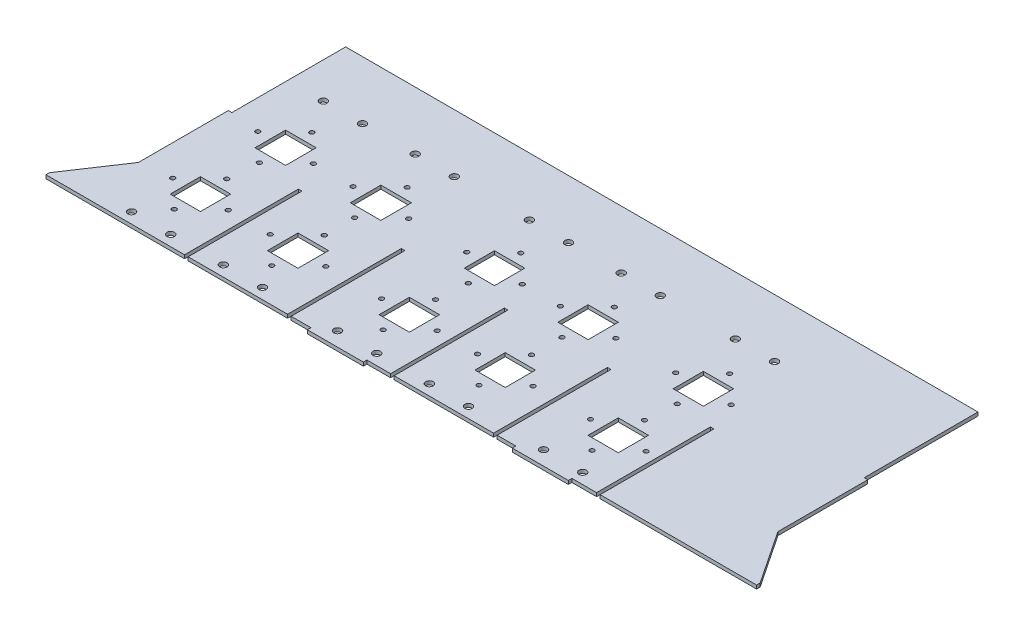
from build123d import *

# Parameters (mm, degrees)
SKETCH1_W            = 570.861
SKETCH1_H            = 3.175
BOSS_EXTRUDE1_DEPTH  = 232.6
SKETCH6_W            = 50
SKETCH6_H            = 3.175
BOSS_EXTRUDE2_DEPTH  = 3.175
SKETCH2_W            = 3.175
SKETCH2_H            = 101.6
CUT_EXTRUDE5_DEPTH   = 371.230335845
BOSS_EXTRUDE3_DEPTH  = 3.175
SKETCH13_W           = 3.175
SKETCH13_H           = 101.6
CUT_EXTRUDE6_DEPTH   = 396.22575932
LPATTERN2_COUNT      = 5
LPATTERN2_PITCH      = 91.9550104
M6_CLEARANCE_HOLE1_D = 6.6
M6_CLEARANCE_HOLE2_D = 6.6
LPATTERN3_COUNT      = 3
LPATTERN3_PITCH      = 183.919999952
LPATTERN4_COUNT      = 2
LPATTERN4_PITCH      = 183.919999952
SKETCH19_W           = 27.300958655
SKETCH19_H           = 27.304060113
SKETCH19_W_2         = 27
SKETCH19_H_2         = 27
CUT_EXTRUDE7_DEPTH   = 396.22575932
SKETCH20_R           = 2
CUT_EXTRUDE8_DEPTH   = 396.327709896


with BuildPart() as part:
    # Sketch1 → Boss-Extrude1 (new body)
    with BuildSketch(Plane.XY):
        Rectangle(SKETCH1_W, SKETCH1_H)
    extrude(amount=BOSS_EXTRUDE1_DEPTH)

    # Sketch6 → Boss-Extrude2 (add)
    with BuildSketch(Plane.XY.offset(232.6)):
        with Locations((127.26300405, 0)):
            Rectangle(SKETCH6_W, SKETCH6_H)
        with Locations((-55.6950692, 0)):
            Rectangle(SKETCH6_W, SKETCH6_H)
    extrude(amount=BOSS_EXTRUDE2_DEPTH)

    # Sketch2 → Cut-Extrude5 (cut, through all)
    with BuildSketch(Plane(origin=(0, 1.5875, 0), x_dir=(1, 0, 0), z_dir=(0, 1, 0))):
        with Locations((283.843, -50.8)):
            Rectangle(SKETCH2_W, SKETCH2_H)
        with Locations((-283.843, -50.8)):
            Rectangle(SKETCH2_W, SKETCH2_H)
    extrude(amount=-CUT_EXTRUDE5_DEPTH, mode=Mode.SUBTRACT)

    # Sketch12 → Boss-Extrude3 (add)
    with BuildSketch(Plane(origin=(0, 1.5875, 0), x_dir=(1, 0, 0), z_dir=(0, 1, 0))):
        Polygon((-317.1805, -232.6), (-285.4305, -232.6), (-285.4305, -181.8), (-317.1805, -229.425), align=None)
    boss_extrude3 = extrude(amount=-BOSS_EXTRUDE3_DEPTH)

    # Mirror1: Boss-Extrude3 across plane
    add(boss_extrude3.mirror(Plane(origin=(0, 0, 0), x_dir=(0, 0, 1), z_dir=(1, 0, 0))))

    # Sketch13 → Cut-Extrude6 (cut, through all)
    with BuildSketch(Plane.XZ.offset(1.5875)):
        with Locations((-191.8879896, 181.8)):
            Rectangle(SKETCH13_W, SKETCH13_H)
    cut_extrude6 = extrude(amount=-CUT_EXTRUDE6_DEPTH, mode=Mode.SUBTRACT)

    # LPattern2: Cut-Extrude6 ×5
    with Locations(*[(i * LPATTERN2_PITCH, 0, 0) for i in range(1, LPATTERN2_COUNT)]):
        add(cut_extrude6, mode=Mode.SUBTRACT)

    # M6 Clearance Hole1 (through all)
    with Locations(Plane(origin=(0, 1.5875, 0), x_dir=(1, 0, 0), z_dir=(0, 1, 0))):
        with Locations((-250.327997081, -223.075), (-215.402997081, -223.075), (-215.402997081, -51.825), (-250.327997081, -51.825)):
            m6_clearance_hole1 = Hole(M6_CLEARANCE_HOLE1_D / 2)

    # M6 Clearance Hole2 (through all)
    with Locations(Plane(origin=(0, 1.5875, 0), x_dir=(1, 0, 0), z_dir=(0, 1, 0))):
        with Locations((-168.370494162, -223.075), (-133.445494162, -223.075), (-168.370494162, -51.825), (-133.445494162, -51.825)):
            m6_clearance_hole2 = Hole(M6_CLEARANCE_HOLE2_D / 2)

    # LPattern3: M6 Clearance Hole1 ×3
    with Locations(*[(i * LPATTERN3_PITCH, 0, 0) for i in range(1, LPATTERN3_COUNT)]):
        add(m6_clearance_hole1, mode=Mode.SUBTRACT)

    # LPattern4: M6 Clearance Hole2 ×2
    with Locations(*[(i * LPATTERN4_PITCH, 0, 0) for i in range(1, LPATTERN4_COUNT)]):
        add(m6_clearance_hole2, mode=Mode.SUBTRACT)

    # Sketch19 → Cut-Extrude7 (cut, through all)
    with BuildSketch(Plane(origin=(0, 1.5875, 0), x_dir=(1, 0, 0), z_dir=(0, 1, 0))):
        with Locations((-231.099915214, -104.789114215)):
            Rectangle(SKETCH19_W, SKETCH19_H)
        with Locations((-146.0465629, -104.789114215)):
            Rectangle(SKETCH19_W, SKETCH19_H)
        with Locations((-233.284631058, -178.622099794)):
            Rectangle(SKETCH19_W_2, SKETCH19_H_2)
        with Locations((-146.0465629, -178.774129851)):
            Rectangle(SKETCH19_W, SKETCH19_H)
        with Locations((-46.784631062, -178.622099794)):
            Rectangle(SKETCH19_W_2, SKETCH19_H_2)
        with Locations((-44.750394541, -104.637084158)):
            Rectangle(SKETCH19_W_2, SKETCH19_H_2)
        with Locations((38.802957773, -104.637084158)):
            Rectangle(SKETCH19_W_2, SKETCH19_H_2)
        with Locations((38.802957773, -178.622099794)):
            Rectangle(SKETCH19_W_2, SKETCH19_H_2)
        with Locations((141.749605459, -104.637084158)):
            Rectangle(SKETCH19_W_2, SKETCH19_H_2)
        with Locations((139.715368938, -178.622099794)):
            Rectangle(SKETCH19_W_2, SKETCH19_H_2)
    extrude(amount=-CUT_EXTRUDE7_DEPTH, mode=Mode.SUBTRACT)

    # Sketch20 → Cut-Extrude8 (cut, through all)
    with BuildSketch(Plane(origin=(0, 7.935000001, 0), x_dir=(1, 0, 0), z_dir=(0, 1, 0))):
        with Locations((-206.464860636, -104.637084158)):
            Circle(SKETCH20_R)
        with Locations((-231.250394541, -128.058151968)):
            Circle(SKETCH20_R)
        with Locations((-256.035928446, -104.637084158)):
            Circle(SKETCH20_R)
        with Locations((-231.250394541, -81.216016348)):
            Circle(SKETCH20_R)
        with Locations((-170.982576132, -178.622099794)):
            Circle(SKETCH20_R)
        with Locations((-146.197042227, -202.043167604)):
            Circle(SKETCH20_R)
        with Locations((-146.197042227, -155.201031984)):
            Circle(SKETCH20_R)
        with Locations((-121.411508322, -178.622099794)):
            Circle(SKETCH20_R)
        with Locations((-21.999097157, -178.622099794)):
            Circle(SKETCH20_R)
        with Locations((-46.784631062, -202.043167604)):
            Circle(SKETCH20_R)
        with Locations((-46.784631062, -155.201031984)):
            Circle(SKETCH20_R)
        with Locations((-71.570164967, -178.622099794)):
            Circle(SKETCH20_R)
        with Locations((-121.411508322, -104.637084158)):
            Circle(SKETCH20_R)
        with Locations((-146.197042227, -128.058151968)):
            Circle(SKETCH20_R)
        with Locations((-170.982576132, -104.637084158)):
            Circle(SKETCH20_R)
        with Locations((-146.197042227, -81.216016348)):
            Circle(SKETCH20_R)
        with Locations((-208.499097153, -178.622099794)):
            Circle(SKETCH20_R)
        with Locations((-233.284631058, -202.043167604)):
            Circle(SKETCH20_R)
        with Locations((-258.070164963, -178.622099794)):
            Circle(SKETCH20_R)
        with Locations((-233.284631058, -155.201031984)):
            Circle(SKETCH20_R)
        with Locations((-44.750394541, -128.058151968)):
            Circle(SKETCH20_R)
        with Locations((-19.964860636, -104.637084158)):
            Circle(SKETCH20_R)
        with Locations((-44.750394541, -81.216016348)):
            Circle(SKETCH20_R)
        with Locations((-69.535928446, -104.637084158)):
            Circle(SKETCH20_R)
        with Locations((38.802957773, -202.043167604)):
            Circle(SKETCH20_R)
        with Locations((63.588491678, -178.622099794)):
            Circle(SKETCH20_R)
        with Locations((38.802957773, -155.201031984)):
            Circle(SKETCH20_R)
        with Locations((14.017423868, -178.622099794)):
            Circle(SKETCH20_R)
        with Locations((38.802957773, -128.058151968)):
            Circle(SKETCH20_R)
        with Locations((14.017423868, -104.637084158)):
            Circle(SKETCH20_R)
        with Locations((63.588491678, -104.637084158)):
            Circle(SKETCH20_R)
        with Locations((38.802957773, -81.216016348)):
            Circle(SKETCH20_R)
        with Locations((139.715368938, -202.043167604)):
            Circle(SKETCH20_R)
        with Locations((114.929835033, -178.622099794)):
            Circle(SKETCH20_R)
        with Locations((164.500902843, -178.622099794)):
            Circle(SKETCH20_R)
        with Locations((139.715368938, -155.201031984)):
            Circle(SKETCH20_R)
        with Locations((166.535139364, -104.637084158)):
            Circle(SKETCH20_R)
        with Locations((141.749605459, -128.058151968)):
            Circle(SKETCH20_R)
        with Locations((116.964071554, -104.637084158)):
            Circle(SKETCH20_R)
        with Locations((141.749605459, -81.216016348)):
            Circle(SKETCH20_R)
    extrude(amount=-CUT_EXTRUDE8_DEPTH, mode=Mode.SUBTRACT)


solid = part.part
